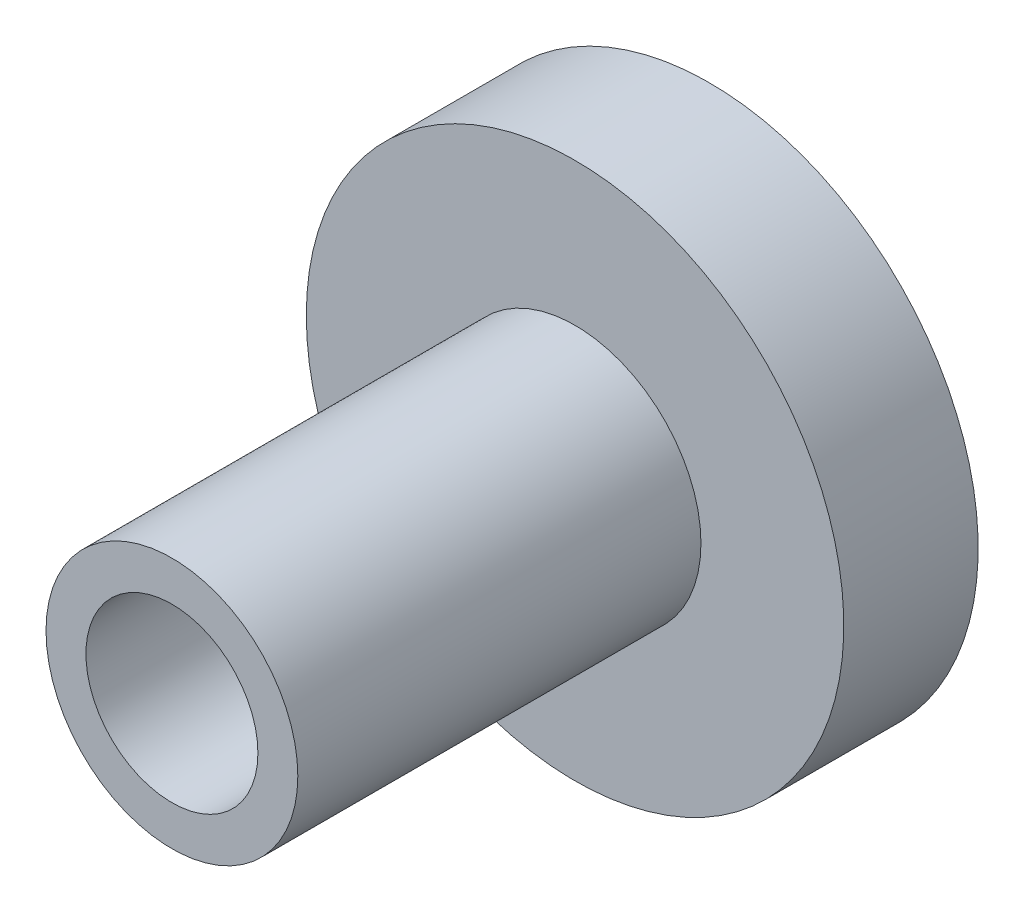
from build123d import *

# Parameters (mm, degrees)
SKETCH1_R           = 5.95
BOSS_EXTRUDE1_DEPTH = 19.05
SKETCH2_R           = 12.7
BOSS_EXTRUDE2_DEPTH = 6.35
SKETCH3_R           = 4.064
CUT_EXTRUDE1_DEPTH  = 15.875
BOSS_EXTRUDE3_REACH = 25.971
SKETCH7_R           = 4.2164
SKETCH7_R_2         = 4.064
CUT_EXTRUDE2_DEPTH  = 4.7625
MOVE_START          = -6.35
MOVE_FACE1_DEPTH    = 4.7625
SKETCH9_W           = 6
SKETCH9_H           = 6
CUT_EXTRUDE3_DEPTH  = 30.024106225
DRAFT1_ANGLE        = 65


# Read off the part's stored shape, not the designer's step: Move Face1
with BuildPart() as part:
    # Sketch1 → Boss-Extrude1 (new body)
    with BuildSketch(Plane.XY):
        with Locations(Location((0, 0, 0), (0, 0, 180))):
            Circle(SKETCH1_R)
    extrude(amount=BOSS_EXTRUDE1_DEPTH)

    # Sketch2 → Boss-Extrude2 (add)
    with BuildSketch(Plane(origin=(0, 0, 0), x_dir=(-1, 0, 0), z_dir=(0, 0, -1))):
        Circle(SKETCH2_R)
    extrude(amount=BOSS_EXTRUDE2_DEPTH)

    # Sketch3 → Cut-Extrude1 (cut)
    with BuildSketch(Plane.XY.offset(19.05)):
        Circle(SKETCH3_R)
    extrude(amount=-CUT_EXTRUDE1_DEPTH, mode=Mode.SUBTRACT)

    # Sketch6 → CSK for #8 Flat Head Machine Screw (100)1 (revolve, cut)
    with BuildSketch(Plane(origin=(0, 0, 3.175), x_dir=(0, -1, 0), z_dir=(1, 0, 0))):
        Polygon((0, 0), (0, 9.525), (2.2479, 9.525), (2.2479, 1.651767624), (4.2164, 0), align=None)
    revolve(axis=Axis((0, 0, 9.525), (0, 0, -1)), mode=Mode.SUBTRACT)

    # Sketch7 → Boss-Extrude3 (add, up to next)
    with BuildSketch(Plane(origin=(0, 0, 3.175), x_dir=(-1, 0, 0), z_dir=(0, 0, -1)), mode=Mode.PRIVATE) as boss_extrude3_sk1:
        Circle(SKETCH7_R)
        with Locations(Location((0, 0, 0), (0, 0, 180))):
            Circle(SKETCH7_R_2, mode=Mode.SUBTRACT)
    boss_extrude3_tool1 = extrude(boss_extrude3_sk1.sketch, amount=BOSS_EXTRUDE3_REACH, mode=Mode.PRIVATE) - part.part
    add(boss_extrude3_tool1.solids().sort_by_distance((4.097142, 0, 3.175))[0])

    # Sketch8 → Cut-Extrude2 (cut)
    with BuildSketch(Plane(origin=(0, 0, -6.35), x_dir=(-1, 0, 0), z_dir=(0, 0, -1))):
        Polygon((2.529660204, -4.3815), (5.059320409, 0), (2.529660204, 4.3815), (-2.529660204, 4.3815), (-5.059320409, 0), (-2.529660204, -4.3815), align=None)
    extrude(amount=-CUT_EXTRUDE2_DEPTH, mode=Mode.SUBTRACT)

    # Move Face1 outline → Move Face1 (cut)
    with BuildSketch(Plane.XY.offset(MOVE_START)):
        Polygon((-5.352614346, 0), (-2.676307173, -4.6355), (2.676307173, -4.6355), (5.352614346, 0), (2.676307173, 4.6355), (-2.676307173, 4.6355), align=None)
        Polygon((2.529660204, -4.3815), (-2.529660204, -4.3815), (-5.059320409, 0), (-2.529660204, 4.3815), (2.529660204, 4.3815), (5.059320409, 0), align=None, mode=Mode.SUBTRACT)
    extrude(amount=MOVE_FACE1_DEPTH, mode=Mode.SUBTRACT)

    # Sketch9 → Cut-Extrude3 (cut, through all)
    with BuildSketch(Plane.ZY.offset(5.138336307)):
        with Locations((9, 0)):
            Rectangle(SKETCH9_W, SKETCH9_H)
    extrude(amount=CUT_EXTRUDE3_DEPTH, mode=Mode.SUBTRACT)

    # Draft1
    draft1_faces = [part.faces().sort_by_distance(p)[0] for p in [
        (-5.464978006, 0, 12),
        (-5.464978006, 0, 6),
    ]]
    draft(draft1_faces, Plane(origin=(-5.138336307, 0, 0), x_dir=(0, 0, -1), z_dir=(-1, 0, 0)), DRAFT1_ANGLE)


solid = part.part
